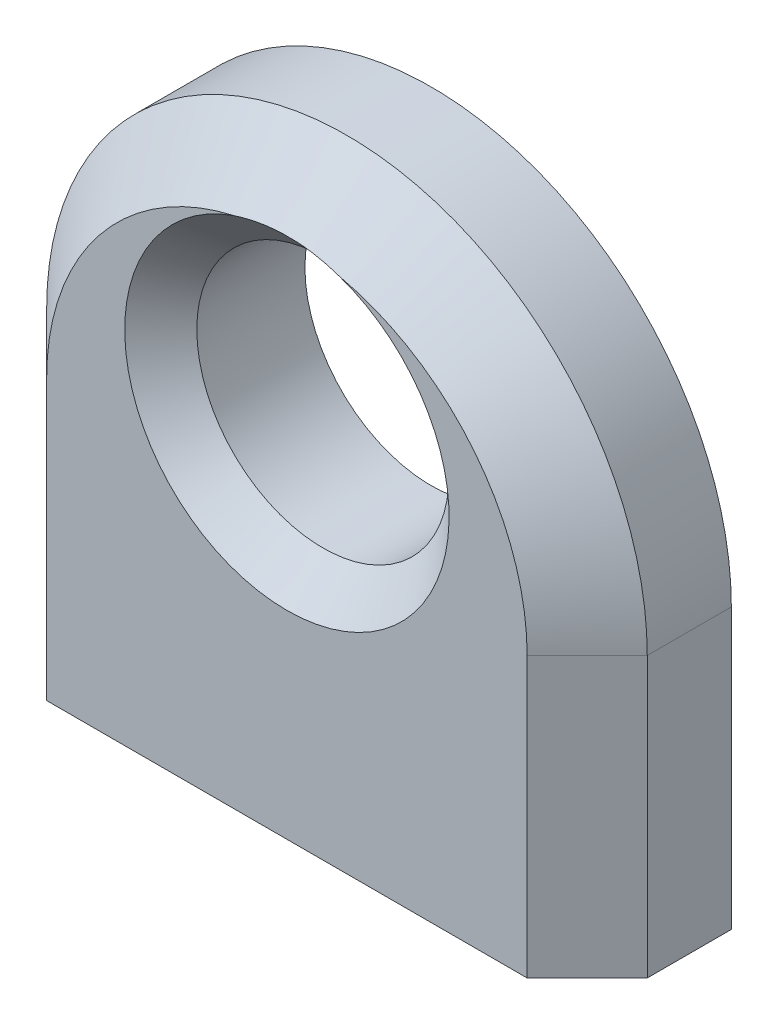
from build123d import *

# Parameters (mm, degrees)
BOSS_EXTRUDE1_DEPTH = 2.4
SKETCH2_R           = 2.1
CUT_EXTRUDE1_DEPTH  = 3
CHAMFER1_SIZE       = 1
CHAMFER2_SIZE       = 0.6
CUT_EXTRUDE2_DEPTH  = 0.4


with BuildPart() as part:
    # Sketch1 → Boss-Extrude1 (new body)
    with BuildSketch(Plane.XY):
        with BuildLine():
            Line((0, 0), (10, 0))
            Line((10, 0), (10, 4.650741911))
            ThreePointArc((10, 4.650741911), (5, 9.650741911), (0, 4.650741911))
            Line((0, 4.650741911), (0, 0))
        make_face()
    extrude(amount=BOSS_EXTRUDE1_DEPTH)

    # Sketch2 → Cut-Extrude1 (cut)
    with BuildSketch(Plane.XY.offset(2.4)):
        with Locations((5, 6)):
            Circle(SKETCH2_R)
    extrude(amount=-CUT_EXTRUDE1_DEPTH, mode=Mode.SUBTRACT)

    # Chamfer1
    chamfer1_edges = [part.edges().sort_by_distance(p)[0] for p in [
        (10, 2.325370955, 2.4),
        (5, 9.650741911, 2.4),
        (0, 2.325370955, 2.4),
    ]]
    chamfer(chamfer1_edges, length=CHAMFER1_SIZE)

    # Chamfer2
    # the kernel refuses this chamfer: 0.6 mm, written as the material it takes off along each edge
    with BuildSketch(Plane(origin=(5, 6, 2.4), x_dir=(1, 0, 0), z_dir=(0, -1, 0))) as chamfer2_piece_1:
        Polygon((2.1 + CHAMFER2_SIZE, 0), (2.1, -CHAMFER2_SIZE), (2.1, 0), align=None)
    revolve(axis=Axis((5, 6, 2.4), (0, 0, 1)), mode=Mode.SUBTRACT)

    # Sketch3 → Cut-Extrude2 (cut)
    # profile 1 of 3: a face of its own
    with BuildSketch(Plane(origin=(0, 0, 0), x_dir=(-1, 0, 0), z_dir=(0, 0, -1))):
        with BuildLine():
            add(Edge.make_bspline(
                [(-7.33244615, 2.792770586), (-7.284454878, 2.791748695), (-7.19035572, 2.789745016), (-7.052547834, 2.768330051), (-6.921002698, 2.735582686), (-6.795216506, 2.690311124), (-6.676800211, 2.629629174), (-6.564028966, 2.557219882), (-6.457211958, 2.471437289), (-6.393188928, 2.405079221), (-6.360691343, 2.371396387)],
                knots=[0, 0, 0, 0, 1.054011418, 2.066658804, 3.057071809, 4.030435133, 4.997543892, 5.974964718, 6.972108034, 8, 8, 8, 8], degree=3))
            add(Edge.make_bspline(
                [(-6.360691343, 2.371396387), (-6.332709389, 2.339182402), (-6.277287008, 2.275377859), (-6.20622129, 2.171922247), (-6.144999729, 2.064782146), (-6.095936768, 1.952534819), (-6.057251745, 1.836160148), (-6.029786049, 1.715258137), (-6.013449114, 1.59009579), (-6.011246147, 1.505091952), (-6.010130445, 1.46204142)],
                knots=[0, 0, 0, 0, 1.025258237, 2.030674902, 3.01204498, 3.988269485, 4.97094183, 5.956517959, 6.965070386, 8, 8, 8, 8], degree=3))
            add(Edge.make_bspline(
                [(-6.010130445, 1.46204142), (-6.011111783, 1.418741362), (-6.013050951, 1.333178429), (-6.031394567, 1.207159063), (-6.059925653, 1.08496424), (-6.100757491, 0.967105546), (-6.153115601, 0.853222719), (-6.217006288, 0.74381317), (-6.292877905, 0.638661036), (-6.378881902, 0.538659198), (-6.473933778, 0.446492983), (-6.577049927, 0.366164714), (-6.68620396, 0.297343189), (-6.802847314, 0.241906774), (-6.9259148, 0.198197073), (-7.055671868, 0.167497057), (-7.191916939, 0.148935373), (-7.28494416, 0.1465518), (-7.33244615, 0.145334689)],
                knots=[0, 0, 0, 0, 0.998656419, 1.973391657, 2.932242238, 3.890759089, 4.846373663, 5.82037756, 6.809684879, 7.83454468, 8.860553229, 9.859544525, 10.845671541, 11.83227036, 12.833544569, 13.85385346, 14.904124723, 16, 16, 16, 16], degree=3))
            add(Edge.make_bspline(
                [(-7.33244615, 0.145334689), (-7.38018087, 0.146555885), (-7.47367173, 0.148947659), (-7.610397712, 0.167424942), (-7.74038733, 0.198182925), (-7.863615929, 0.242050417), (-7.980760776, 0.297344961), (-8.090547273, 0.365956651), (-8.193747188, 0.446516806), (-8.288819173, 0.538652743), (-8.374817778, 0.638662699), (-8.450690787, 0.743812738), (-8.514581113, 0.853222831), (-8.566939317, 0.967105516), (-8.607771129, 1.084964248), (-8.636302222, 1.207159061), (-8.654645837, 1.333178429), (-8.656585005, 1.418741362), (-8.657566343, 1.46204142)],
                knots=[0, 0, 0, 0, 1.099876186, 2.154163076, 3.173186993, 4.173200201, 5.163417411, 6.152872554, 7.150605724, 8.17532212, 9.198891216, 10.186952605, 11.159729845, 12.11414092, 13.071450619, 14.029093627, 15.002601286, 16, 16, 16, 16], degree=3))
            add(Edge.make_bspline(
                [(-8.657566343, 1.46204142), (-8.656443032, 1.504857965), (-8.654219071, 1.589627368), (-8.637898562, 1.714554428), (-8.610540005, 1.835251818), (-8.571808609, 1.951177294), (-8.522293418, 2.06293273), (-8.46193213, 2.170337561), (-8.390141497, 2.273325361), (-8.334939546, 2.337047441), (-8.307005445, 2.369293022)],
                knots=[0, 0, 0, 0, 1.031353054, 2.041901799, 3.029428768, 4.008703097, 4.981709435, 5.96992636, 6.972712378, 8, 8, 8, 8], degree=3))
            add(Edge.make_bspline(
                [(-8.307005445, 2.369293022), (-8.274556854, 2.403267961), (-8.21074099, 2.470085658), (-8.103392263, 2.555618182), (-7.990898442, 2.629534256), (-7.871173515, 2.689010471), (-7.745490657, 2.735848989), (-7.613271415, 2.768414504), (-7.474995899, 2.789667859), (-7.380436278, 2.791726037), (-7.33244615, 2.792770586)],
                knots=[0, 0, 0, 0, 1.027980169, 2.021703884, 2.998553061, 3.971491411, 4.943284454, 5.930300938, 6.949603206, 8, 8, 8, 8], degree=3))
        make_face()
        with BuildLine():
            add(Edge.make_bspline(
                [(-7.333848394, 2.478668022), (-7.367786005, 2.47770343), (-7.434785134, 2.475799148), (-7.533404719, 2.461315243), (-7.628344873, 2.438367739), (-7.719785717, 2.405763683), (-7.807418889, 2.363664784), (-7.891328292, 2.311956424), (-7.971760731, 2.251323467), (-8.047142795, 2.181860796), (-8.116325107, 2.105981801), (-8.176803084, 2.025133442), (-8.22822819, 1.940627096), (-8.271068349, 1.852374885), (-8.302975537, 1.759482471), (-8.326148559, 1.66300184), (-8.3406188, 1.562736423), (-8.342505179, 1.494575405), (-8.343463779, 1.459938054)],
                knots=[0, 0, 0, 0, 1.021534396, 2.016698045, 2.994645724, 3.958388632, 4.93408049, 5.916473867, 6.921342795, 7.962252576, 8.998418191, 10.008913653, 10.997312074, 11.973003931, 12.956656626, 13.948281152, 14.957379055, 16, 16, 16, 16], degree=3))
            add(Edge.make_bspline(
                [(-8.343463779, 1.459938054), (-8.341856955, 1.415186027), (-8.33866771, 1.326361621), (-8.312732474, 1.195550499), (-8.269346194, 1.069968647), (-8.210758914, 0.950352261), (-8.137352696, 0.839679983), (-8.050865629, 0.741008498), (-7.952225929, 0.655822687), (-7.842609429, 0.585141841), (-7.724255111, 0.528982086), (-7.59899879, 0.48918311), (-7.468358095, 0.463311417), (-7.379077364, 0.460739943), (-7.333848394, 0.459437253)],
                knots=[0, 0, 0, 0, 1.016792936, 2.018143844, 3.017858371, 4.030088057, 5.03801393, 6.028138512, 7.003788237, 7.991172063, 8.984598303, 9.972568034, 10.972917682, 12, 12, 12, 12], degree=3))
            add(Edge.make_bspline(
                [(-7.333848394, 0.459437253), (-7.288622025, 0.460747533), (-7.199346429, 0.46333399), (-7.068887252, 0.48905281), (-6.94397328, 0.52915647), (-6.825741893, 0.58507868), (-6.716175289, 0.656091095), (-6.616826168, 0.740527472), (-6.531077557, 0.839941323), (-6.457743952, 0.950498852), (-6.398197209, 1.069783204), (-6.355014008, 1.195573677), (-6.329016422, 1.326355719), (-6.325835593, 1.415184049), (-6.324233009, 1.459938054)],
                knots=[0, 0, 0, 0, 1.02726834, 2.027799167, 3.010890988, 4.004497153, 4.992059811, 5.971914811, 6.958719428, 7.966827853, 8.981595046, 9.981490638, 10.983022906, 12, 12, 12, 12], degree=3))
            add(Edge.make_bspline(
                [(-6.324233009, 1.459938054), (-6.325191279, 1.494575612), (-6.327077008, 1.562737038), (-6.341551973, 1.662999491), (-6.364707513, 1.759491088), (-6.39667913, 1.852343091), (-6.439333144, 1.940855595), (-6.491749937, 2.024885322), (-6.551980962, 2.106261868), (-6.621998083, 2.181615509), (-6.697301461, 2.251350546), (-6.777766499, 2.311979935), (-6.861551478, 2.363437531), (-6.94893006, 2.406123771), (-7.040382628, 2.438071112), (-7.135189757, 2.461447743), (-7.233388567, 2.47573794), (-7.30014761, 2.477685081), (-7.333848394, 2.478668022)],
                knots=[0, 0, 0, 0, 1.042956736, 2.052379634, 3.044323526, 4.02829302, 5.004299113, 5.996692471, 7.007513377, 8.048758398, 9.090003419, 10.095195979, 11.07790575, 12.047570684, 13.018257071, 13.989683339, 14.985167495, 16, 16, 16, 16], degree=3))
        make_face(mode=Mode.SUBTRACT)
    # profile 2 of 3: a face of its own
    with BuildSketch(Plane(origin=(0, 0, 0), x_dir=(-1, 0, 0), z_dir=(0, 0, -1))):
        with BuildLine():
            Line((-5.426797112, 2.747898791), (-5.112694548, 2.747898791))
            Line((-5.112694548, 2.747898791), (-5.112694548, 1.561600714))
            add(Edge.make_bspline(
                [(-5.112694548, 1.561600714), (-5.112552643, 1.526777965), (-5.112281185, 1.460163677), (-5.110440245, 1.36430849), (-5.106110151, 1.276891778), (-5.100696326, 1.197863041), (-5.09373419, 1.127235649), (-5.08545083, 1.065256292), (-5.076192408, 1.011222108), (-5.067129694, 0.978678753), (-5.0629149, 0.963543823)],
                knots=[0, 0, 0, 0, 1.388932606, 2.656963016, 3.823490214, 4.879454478, 5.816252168, 6.653371382, 7.373723809, 8, 8, 8, 8], degree=3))
            add(Edge.make_bspline(
                [(-5.0629149, 0.963543823), (-5.056153445, 0.944520952), (-5.042771104, 0.906870691), (-5.018497621, 0.852481686), (-4.988469284, 0.802106404), (-4.955609456, 0.753802331), (-4.917710049, 0.709000344), (-4.875250577, 0.6677761), (-4.82965234, 0.628572009), (-4.761897317, 0.582187217), (-4.669238051, 0.532471887), (-4.547585296, 0.489576069), (-4.41568107, 0.463940249), (-4.324516351, 0.460965994), (-4.27765849, 0.459437253)],
                knots=[0, 0, 0, 0, 0.725840625, 1.436591201, 2.137033971, 2.831655856, 3.53531722, 4.242432219, 4.957935707, 5.694543706, 7.190802206, 8.724350549, 10.316345118, 12, 12, 12, 12], degree=3))
            add(Edge.make_bspline(
                [(-4.27765849, 0.459437253), (-4.230804982, 0.460998501), (-4.140152114, 0.464019229), (-4.009697145, 0.488802767), (-3.89044573, 0.530208456), (-3.783594779, 0.588015868), (-3.689628939, 0.658757931), (-3.61132452, 0.74176674), (-3.546717266, 0.834416126), (-3.518507845, 0.903540405), (-3.50432115, 0.938303439)],
                knots=[0, 0, 0, 0, 1.157059328, 2.238695713, 3.266970494, 4.264342957, 5.228770407, 6.160125903, 7.074715775, 8, 8, 8, 8], degree=3))
            add(Edge.make_bspline(
                [(-3.50432115, 0.938303439), (-3.50012692, 0.952269737), (-3.490854502, 0.983145813), (-3.48089215, 1.035525561), (-3.471917689, 1.097990166), (-3.464254513, 1.170948374), (-3.45878935, 1.254209527), (-3.455843324, 1.347747603), (-3.452515048, 1.451268963), (-3.452464532, 1.523736723), (-3.452438138, 1.561600714)],
                knots=[0, 0, 0, 0, 0.557542046, 1.232589297, 2.036731608, 2.971723315, 4.038036528, 5.22795436, 6.551621927, 8, 8, 8, 8], degree=3))
            Line((-3.452438138, 1.561600714), (-3.452438138, 2.747898791))
            Line((-3.452438138, 2.747898791), (-3.138335573, 2.747898791))
            Line((-3.138335573, 2.747898791), (-3.138335573, 1.502706484))
            add(Edge.make_bspline(
                [(-3.138335573, 1.502706484), (-3.138777268, 1.460399312), (-3.139634217, 1.378317612), (-3.14514156, 1.259033501), (-3.154591173, 1.147871256), (-3.168933858, 1.044772036), (-3.185799532, 0.949814554), (-3.207555805, 0.862877108), (-3.233534043, 0.784227554), (-3.262839558, 0.712485777), (-3.297461426, 0.647438883), (-3.334288446, 0.585703067), (-3.376813218, 0.528810131), (-3.421583452, 0.473927994), (-3.471385108, 0.423786467), (-3.525284967, 0.377234991), (-3.582524387, 0.333561959), (-3.644373585, 0.29447068), (-3.709929648, 0.259254035), (-3.779273505, 0.228037956), (-3.853254503, 0.203335379), (-3.93091814, 0.182024714), (-4.012644919, 0.165310244), (-4.098356052, 0.153523678), (-4.188022669, 0.146298347), (-4.249132128, 0.145661302), (-4.280462977, 0.145334689)],
                knots=[0, 0, 0, 0, 1.493040784, 2.896703357, 4.213163133, 5.428574705, 6.569057535, 7.615249723, 8.588095153, 9.490268104, 10.346124644, 11.18633936, 12.024365274, 12.850166724, 13.684164916, 14.514361689, 15.362232829, 16.222528818, 17.093394965, 17.986930858, 18.902426812, 19.842810585, 20.827885679, 21.843828298, 22.894529745, 24, 24, 24, 24], degree=3))
            add(Edge.make_bspline(
                [(-4.280462977, 0.145334689), (-4.311559491, 0.145674396), (-4.372667036, 0.146341952), (-4.462338281, 0.15348376), (-4.548286887, 0.16529193), (-4.630207286, 0.182147148), (-4.708181683, 0.203186218), (-4.782525923, 0.228189753), (-4.852369486, 0.259270235), (-4.91855149, 0.294247792), (-4.980553878, 0.333813068), (-5.038662456, 0.377181107), (-5.092799309, 0.424287171), (-5.142976377, 0.474934528), (-5.188489353, 0.529751464), (-5.229905395, 0.588297024), (-5.2678621, 0.649991113), (-5.30221489, 0.716054275), (-5.331726646, 0.788626285), (-5.357781892, 0.868923382), (-5.37909253, 0.957825899), (-5.396434999, 1.055257828), (-5.410386439, 1.160752869), (-5.420072581, 1.274921284), (-5.425488412, 1.397484977), (-5.426351474, 1.482134867), (-5.426797112, 1.525843503)],
                knots=[0, 0, 0, 0, 1.083640291, 2.129454052, 3.13281866, 4.105697902, 5.042300162, 5.946461698, 6.836384745, 7.703652036, 8.553297018, 9.397182691, 10.228592656, 11.052265423, 11.879314572, 12.708807002, 13.549817954, 14.402308542, 15.300838682, 16.27712199, 17.341985831, 18.484375296, 19.725102775, 21.0496083, 22.476576903, 24, 24, 24, 24], degree=3))
            Line((-5.426797112, 1.525843503), (-5.426797112, 2.747898791))
        make_face()
    # profile 3 of 3: a face of its own
    with BuildSketch(Plane(origin=(0, 0, 0), x_dir=(-1, 0, 0), z_dir=(0, 0, -1))):
        Polygon((-2.106284291, 3.779950073), (-1.792181727, 3.779950073), (-1.792181727, 2.747898791), (-1.343463779, 2.747898791), (-1.343463779, 2.433796227), (-1.792181727, 2.433796227), (-1.792181727, 0.190206484), (-2.106284291, 0.190206484), (-2.106284291, 2.433796227), (-2.55500224, 2.433796227), (-2.55500224, 2.747898791), (-2.106284291, 2.747898791), align=None)
    extrude(amount=-CUT_EXTRUDE2_DEPTH, mode=Mode.SUBTRACT)


solid = part.part
